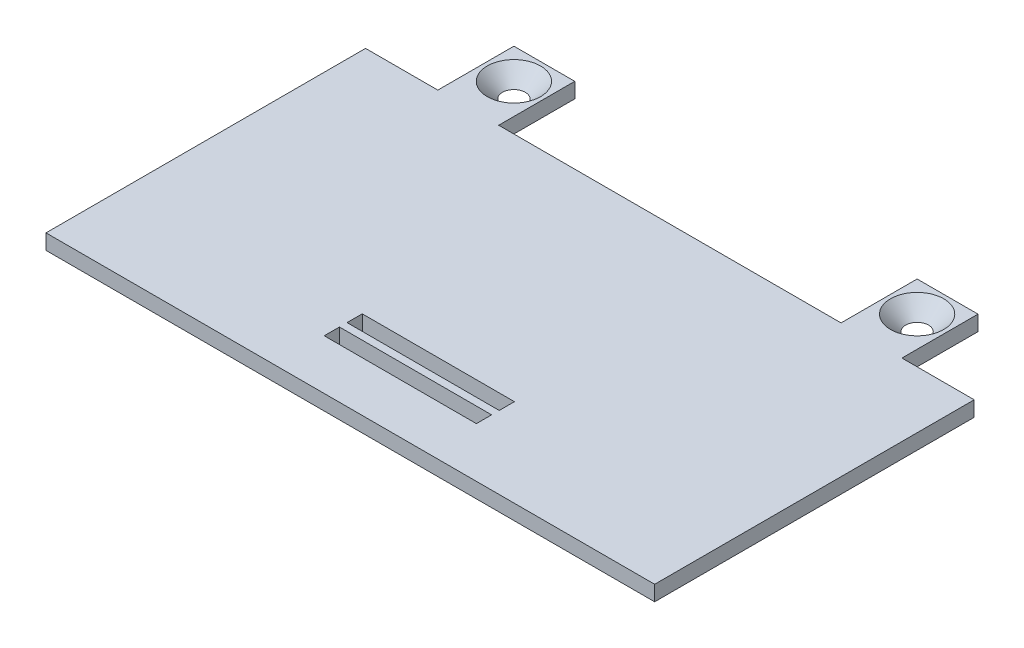
from build123d import *

# Parameters (mm, degrees)
SKETCH_4_W               = 80
SKETCH_4_H               = 52
EXTRUDE_2_DEPTH          = 2
CUT_EXTRUDE_4_DEPTH      = 35
CUT_EXTRUDE_4_DEPTH_BACK = 32
SKETCH_5_W               = 9.5
SKETCH_5_H               = 10
CUT_EXTRUDE_5_DEPTH      = 54
CUT_EXTRUDE_5_DEPTH_BACK = 45
SKETCH_6_W               = 45
SKETCH_6_H               = 10
CUT_EXTRUDE_6_DEPTH      = 64
CUT_EXTRUDE_6_DEPTH_BACK = 67
SKETCH_7_W               = 9.5
SKETCH_7_H               = 10
CUT_EXTRUDE_7_DEPTH      = 30
CUT_EXTRUDE_7_DEPTH_BACK = 30
SKETCH_8_R               = 1.5
CHAMFER_1_SIZE           = 2
CUT_EXTRUDE_8_DEPTH      = 20
CUT_EXTRUDE_8_DEPTH_BACK = 33
SKETCH_9_R               = 1.5
CHAMFER_2_SIZE           = 2
SKETCH_10_W              = 20
SKETCH_10_H              = 2
CUT_EXTRUDE_9_DEPTH      = 2


with BuildPart() as part:
    # Эскиз4 → Бобышка-Вытянуть2 (new body)
    with BuildSketch(Plane(origin=(0, 0, 0), x_dir=(1, 0, 0), z_dir=(0, 1, 0))):
        with Locations((3.117803535, 35.377543141)):
            Rectangle(SKETCH_4_W, SKETCH_4_H)
    extrude(amount=-EXTRUDE_2_DEPTH)

    # Эскиз5 → Вырез-Вытянуть4 (cut, two sides: drawn at the far end of the back side and taken through both)
    with BuildSketch(Plane(origin=(0, 0, 0), x_dir=(1, 0, 0), z_dir=(0, 1, 0)).offset(-CUT_EXTRUDE_4_DEPTH_BACK)):
        with Locations((-32.132196465, 56.377543141)):
            Rectangle(SKETCH_5_W, SKETCH_5_H)
    extrude(amount=CUT_EXTRUDE_4_DEPTH + CUT_EXTRUDE_4_DEPTH_BACK, mode=Mode.SUBTRACT)

    # Эскиз6 → Вырез-Вытянуть5 (cut, two sides: drawn at the far end of the back side and taken through both)
    with BuildSketch(Plane(origin=(0, 0, 0), x_dir=(1, 0, 0), z_dir=(0, 1, 0)).offset(-CUT_EXTRUDE_5_DEPTH_BACK)):
        with Locations((3.117803535, 56.377543141)):
            Rectangle(SKETCH_6_W, SKETCH_6_H)
    extrude(amount=CUT_EXTRUDE_5_DEPTH + CUT_EXTRUDE_5_DEPTH_BACK, mode=Mode.SUBTRACT)

    # Эскиз7 → Вырез-Вытянуть6 (cut, two sides: drawn at the far end of the back side and taken through both)
    with BuildSketch(Plane(origin=(0, 0, 0), x_dir=(1, 0, 0), z_dir=(0, 1, 0)).offset(-CUT_EXTRUDE_6_DEPTH_BACK)):
        with Locations((38.367803535, 56.377543141)):
            Rectangle(SKETCH_7_W, SKETCH_7_H)
    extrude(amount=CUT_EXTRUDE_6_DEPTH + CUT_EXTRUDE_6_DEPTH_BACK, mode=Mode.SUBTRACT)

    # Эскиз8 → Вырез-Вытянуть7 (cut, two sides: drawn at the far end of the back side and taken through both)
    with BuildSketch(Plane(origin=(0, 0, 0), x_dir=(1, 0, 0), z_dir=(0, 1, 0)).offset(-CUT_EXTRUDE_7_DEPTH_BACK)):
        with Locations(Location((-23.382196465, 57.377543141, 0), (0, 0, 270))):
            Circle(SKETCH_8_R)
    extrude(amount=CUT_EXTRUDE_7_DEPTH + CUT_EXTRUDE_7_DEPTH_BACK, mode=Mode.SUBTRACT)

    # Фаска1
    chamfer_1_edges = [part.edges().sort_by_distance(p)[0] for p in [
        (-23.382196465, 0, -58.877543141),
    ]]
    chamfer(chamfer_1_edges, length=CHAMFER_1_SIZE - 0.0001)  # a hair under: the kernel refuses the full size

    # Эскиз9 → Вырез-Вытянуть8 (cut, two sides: drawn at the far end of the back side and taken through both)
    with BuildSketch(Plane(origin=(0, 0, 0), x_dir=(1, 0, 0), z_dir=(0, 1, 0)).offset(-CUT_EXTRUDE_8_DEPTH_BACK)):
        with Locations(Location((29.617803535, 57.377543141, 0), (0, 0, 270))):
            Circle(SKETCH_9_R)
    extrude(amount=CUT_EXTRUDE_8_DEPTH + CUT_EXTRUDE_8_DEPTH_BACK, mode=Mode.SUBTRACT)

    # Фаска2
    chamfer_2_edges = [part.edges().sort_by_distance(p)[0] for p in [
        (29.617803535, 0, -58.877543141),
    ]]
    chamfer(chamfer_2_edges, length=CHAMFER_2_SIZE - 0.0001)  # a hair under: the kernel refuses the full size

    # Эскиз10 → Вырез-Вытянуть9 (cut)
    with BuildSketch(Plane(origin=(0, 0, 0), x_dir=(1, 0, 0), z_dir=(0, 1, 0))):
        with Locations((3.117803535, 16.946236335)):
            Rectangle(SKETCH_10_W, SKETCH_10_H)
        with Locations((3.117803535, 19.946236335)):
            Rectangle(SKETCH_10_W, SKETCH_10_H)
    extrude(amount=-CUT_EXTRUDE_9_DEPTH, mode=Mode.SUBTRACT)


solid = part.part
